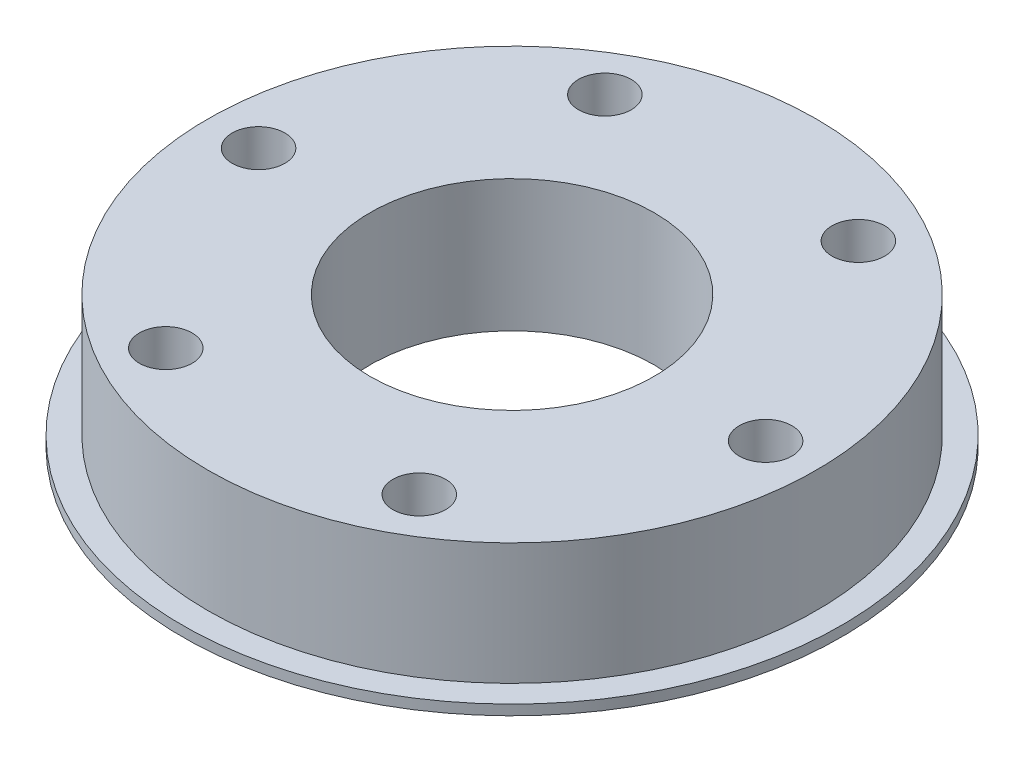
from build123d import *

# Parameters (mm, degrees)
SKETCH1_R           = 30
BOSS_EXTRUDE1_DEPTH = 13
SKETCH2_R           = 32.5
BOSS_EXTRUDE2_DEPTH = 1
SKETCH3_R           = 1.75
CUT_EXTRUDE1_DEPTH  = 3.5
SKETCH4_R           = 14
CUT_EXTRUDE2_DEPTH  = 51
SKETCH5_R           = 2.6
CUT_EXTRUDE3_DEPTH  = 25


with BuildPart() as part:
    # Sketch1 → Boss-Extrude1 (new body)
    with BuildSketch(Plane(origin=(0, 0, 0), x_dir=(1, 0, 0), z_dir=(0, 1, 0))):
        Circle(SKETCH1_R)
    extrude(amount=BOSS_EXTRUDE1_DEPTH)

    # Sketch2 → Boss-Extrude2 (add)
    with BuildSketch(Plane.XZ):
        Circle(SKETCH2_R)
    extrude(amount=-BOSS_EXTRUDE2_DEPTH)

    # Sketch3 → Cut-Extrude1 (cut)
    with BuildSketch(Plane(origin=(0, 0, 0), x_dir=(1, 0, 0), z_dir=(0, 1, 0))):
        with Locations((0, 25)):
            Circle(SKETCH3_R)
        with Locations((21.650635095, 12.5)):
            Circle(SKETCH3_R)
        with Locations((21.650635095, -12.5)):
            Circle(SKETCH3_R)
        with Locations((0, -25)):
            Circle(SKETCH3_R)
        with Locations((-21.650635095, -12.5)):
            Circle(SKETCH3_R)
        with Locations((-21.650635095, 12.5)):
            Circle(SKETCH3_R)
    extrude(amount=CUT_EXTRUDE1_DEPTH, mode=Mode.SUBTRACT)

    # Sketch4 → Cut-Extrude2 (cut)
    with BuildSketch(Plane.XZ):
        Circle(SKETCH4_R)
    extrude(amount=-CUT_EXTRUDE2_DEPTH, mode=Mode.SUBTRACT)

    # Sketch5 → Cut-Extrude3 (cut)
    with BuildSketch(Plane.XZ):
        with Locations((-12.5, 21.650635095)):
            Circle(SKETCH5_R)
        with Locations((12.5, 21.650635095)):
            Circle(SKETCH5_R)
        with Locations((25, 0)):
            Circle(SKETCH5_R)
        with Locations((12.5, -21.650635095)):
            Circle(SKETCH5_R)
        with Locations((-12.5, -21.650635095)):
            Circle(SKETCH5_R)
        with Locations((-25, 0)):
            Circle(SKETCH5_R)
    extrude(amount=-CUT_EXTRUDE3_DEPTH, mode=Mode.SUBTRACT)


solid = part.part
